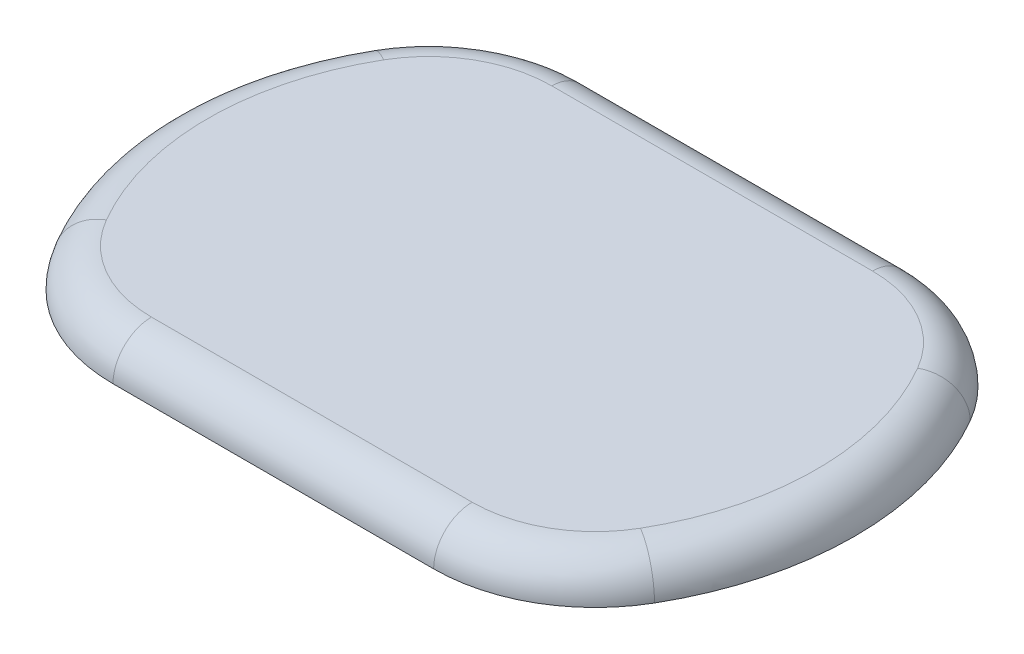
from build123d import *

# Parameters (mm, degrees)
SKETCH_1_W          = 89
SKETCH_1_H          = 62
EXTRUDE_1_DEPTH     = 5
CUT_EXTRUDE_START   = -5.000001
SKETCH_2_W          = 114.345269922
SKETCH_2_H          = 82.741202996
CUT_EXTRUDE_2_DEPTH = 5.000002
FILLET_1_R          = 5


with BuildPart() as part:
    # 草图1 → 凸台-拉伸1 (new body)
    with BuildSketch(Plane(origin=(0, 0, 0), x_dir=(1, 0, 0), z_dir=(0, 1, 0))):
        with Locations((-7.7, -10.288888889)):
            Rectangle(SKETCH_1_W, SKETCH_1_H)
    extrude(amount=EXTRUDE_1_DEPTH)

    # 草图2 → 切除-拉伸2 (cut)
    with BuildSketch(Plane(origin=(0, 5, 0), x_dir=(1, 0, 0), z_dir=(0, 1, 0)).offset(CUT_EXTRUDE_START)):
        with Locations((-11.341983823, -7.488413354)):
            Rectangle(SKETCH_2_W, SKETCH_2_H)
        with BuildLine():
            Line((-28.520508076, 20.711111111), (13.120508076, 20.711111111))
            ThreePointArc((13.120508076, 20.711111111), (23.620508076, 17.897644591), (31.307041555, 10.211111111))
            ThreePointArc((31.307041555, 10.211111111), (36.8, -10.288888889), (31.307041555, -30.788888889))
            ThreePointArc((31.307041555, -30.788888889), (23.620508076, -38.475422368), (13.120508076, -41.288888889))
            Line((13.120508076, -41.288888889), (-28.520508076, -41.288888889))
            ThreePointArc((-28.520508076, -41.288888889), (-39.020508076, -38.475422368), (-46.707041555, -30.788888889))
            ThreePointArc((-46.707041555, -30.788888889), (-52.2, -10.288888889), (-46.707041555, 10.211111111))
            ThreePointArc((-46.707041555, 10.211111111), (-39.020508076, 17.897644591), (-28.520508076, 20.711111111))
        make_face(mode=Mode.SUBTRACT)
    extrude(amount=CUT_EXTRUDE_2_DEPTH, mode=Mode.SUBTRACT)

    # 圆角1
    fillet_1_edges = [part.edges().sort_by_distance(p)[0] for p in [
        (36.8, 5, 10.288888889),
        (23.620508076, 5, 38.475422368),
        (-7.7, 5, 41.288888889),
        (-39.020508076, 5, 38.475422368),
        (-52.2, 5, 10.288888889),
        (-39.020508076, 5, -17.897644591),
        (-7.7, 5, -20.711111111),
        (23.620508076, 5, -17.897644591),
    ]]
    fillet(fillet_1_edges, radius=FILLET_1_R - 0.0001)  # a hair under: the kernel refuses the full size


solid = part.part
